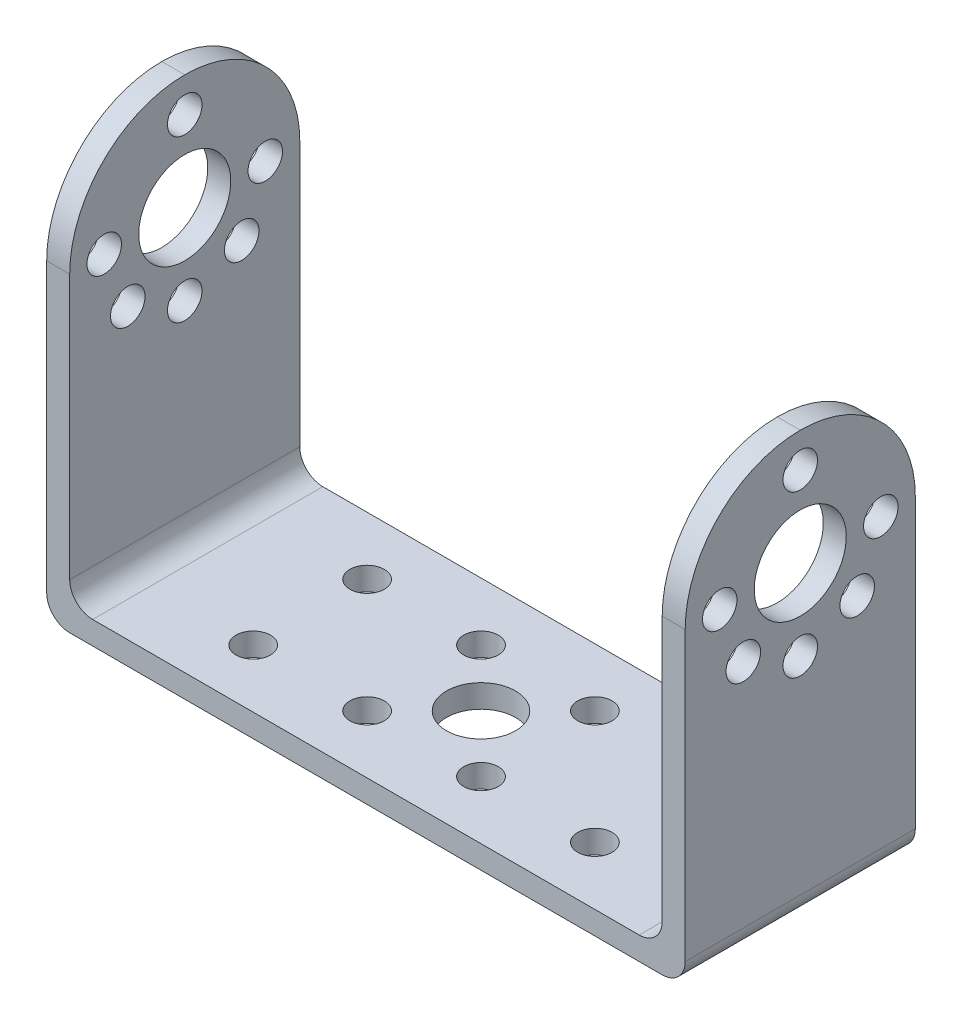
from build123d import *

# Parameters (mm, degrees)
EXTRUDE_933_DEPTH      = 20
SKETCH6_R              = 3
SKETCH6_R_2            = 1.5
CUT_EXTRUDE_1730_DEPTH = 70
SKETCH7_R              = 1.5
SKETCH7_R_2            = 4
CUT_EXTRUDE_2086_DEPTH = 55.5
FILLET1_R              = 10
FILLET2_R              = 2


with BuildPart() as part:
    # Sketch2 → Extrude 933 (new body)
    with BuildSketch(Plane.XY):
        Polygon((0, 0), (55.5, 0), (55.5, 37), (53.5, 37), (53.5, 2), (2, 2), (2, 37), (0, 37), align=None)
    extrude(amount=EXTRUDE_933_DEPTH)

    # Sketch6 → Cut-Extrude 1730 (cut)
    with BuildSketch(Plane(origin=(0, 0, 0), x_dir=(-1, 0, 0), z_dir=(0, -1, 0))):
        with Locations(Location((-27.75, -10, 0), (0, 0, 180))):
            Circle(SKETCH6_R)
        with Locations(Location((-32.699747468, -14.949747468, 0), (0, 0, 270))):
            Circle(SKETCH6_R_2)
        with Locations(Location((-32.699747468, -5.050252532, 0), (0, 0, 180))):
            Circle(SKETCH6_R_2)
        with Locations(Location((-42.599747468, -14.949747468, 0), (0, 0, 270))):
            Circle(SKETCH6_R_2)
        with Locations(Location((-42.599747468, -5.050252532, 0), (0, 0, 180))):
            Circle(SKETCH6_R_2)
        with Locations(Location((-12.900252532, -5.050252532, 0), (0, 0, 270))):
            Circle(SKETCH6_R_2)
        with Locations(Location((-22.800252532, -5.050252532, 0), (0, 0, 270))):
            Circle(SKETCH6_R_2)
        with Locations(Location((-22.800252532, -14.949747468, 0), (0, 0, 180))):
            Circle(SKETCH6_R_2)
        with Locations(Location((-12.900252532, -14.949747468, 0), (0, 0, 180))):
            Circle(SKETCH6_R_2)
    extrude(amount=-CUT_EXTRUDE_1730_DEPTH, mode=Mode.SUBTRACT)

    # Sketch7 → Cut-Extrude 2086 (cut)
    with BuildSketch(Plane.ZY):
        with Locations(Location((17, 27, 0), (0, 0, 270))):
            Circle(SKETCH7_R)
        with Locations(Location((14.949747468, 22.050252532, 0), (0, 0, 270))):
            Circle(SKETCH7_R)
        with Locations(Location((10, 20, 0), (0, 0, 270))):
            Circle(SKETCH7_R)
        with Locations(Location((5.050252532, 22.050252532, 0), (0, 0, 270))):
            Circle(SKETCH7_R)
        with Locations(Location((10, 34, 0), (0, 0, 270))):
            Circle(SKETCH7_R)
        with Locations(Location((3, 27, 0), (0, 0, 270))):
            Circle(SKETCH7_R)
        with Locations(Location((10, 27, 0), (0, 0, 270))):
            Circle(SKETCH7_R_2)
    extrude(amount=-CUT_EXTRUDE_2086_DEPTH, mode=Mode.SUBTRACT)

    # Fillet1
    fillet1_edges = [part.edges().sort_by_distance(p)[0] for p in [
        (54.5, 37, 20),
        (54.5, 37, 0),
        (1, 37, 0),
        (1, 37, 20),
    ]]
    fillet(fillet1_edges, radius=FILLET1_R - 0.0001)  # a hair under: the kernel refuses the full size

    # Fillet2
    fillet2_edges = [part.edges().sort_by_distance(p)[0] for p in [
        (2, 2, 10),
        (53.5, 2, 10),
        (55.5, 0, 10),
        (0, 0, 10),
    ]]
    fillet(fillet2_edges, radius=FILLET2_R)


solid = part.part
